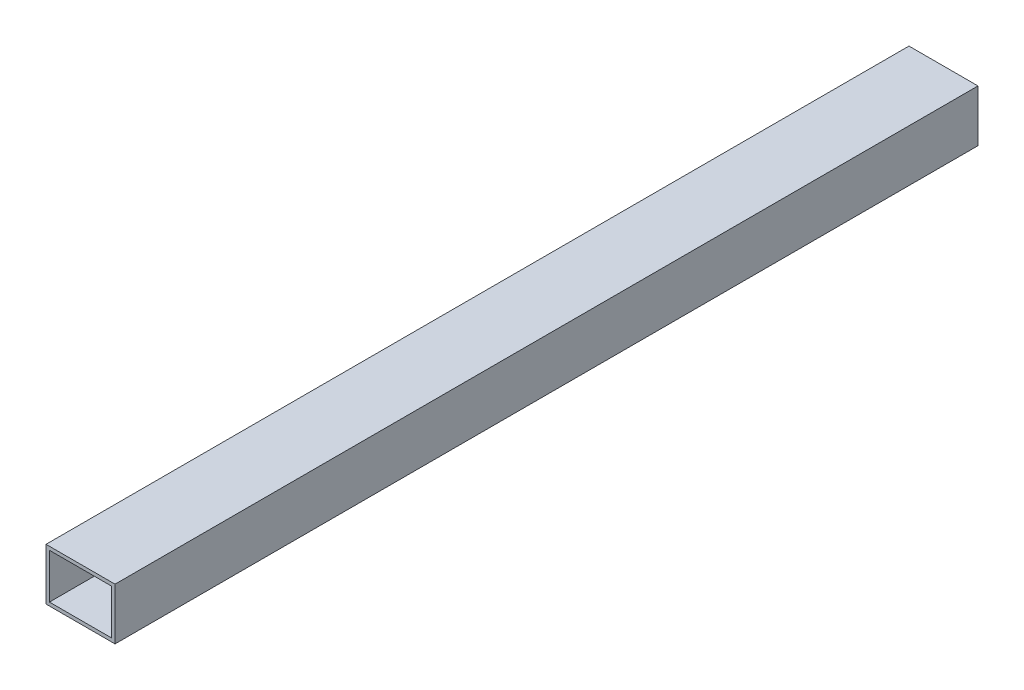
from build123d import *

# Parameters (mm, degrees)
SKETCH_1_W      = 20
SKETCH_1_H      = 15
SKETCH_1_W_2    = 18
SKETCH_1_H_2    = 13
EXTRUDE_1_DEPTH = 250


with BuildPart() as part:
    # 草图1 → 拉伸-薄壁1 (new body)
    with BuildSketch(Plane.XY):
        with Locations((10, -7.5)):
            Rectangle(SKETCH_1_W, SKETCH_1_H)
        with Locations((10, -7.5)):
            Rectangle(SKETCH_1_W_2, SKETCH_1_H_2, mode=Mode.SUBTRACT)
    extrude(amount=EXTRUDE_1_DEPTH)


solid = part.part
